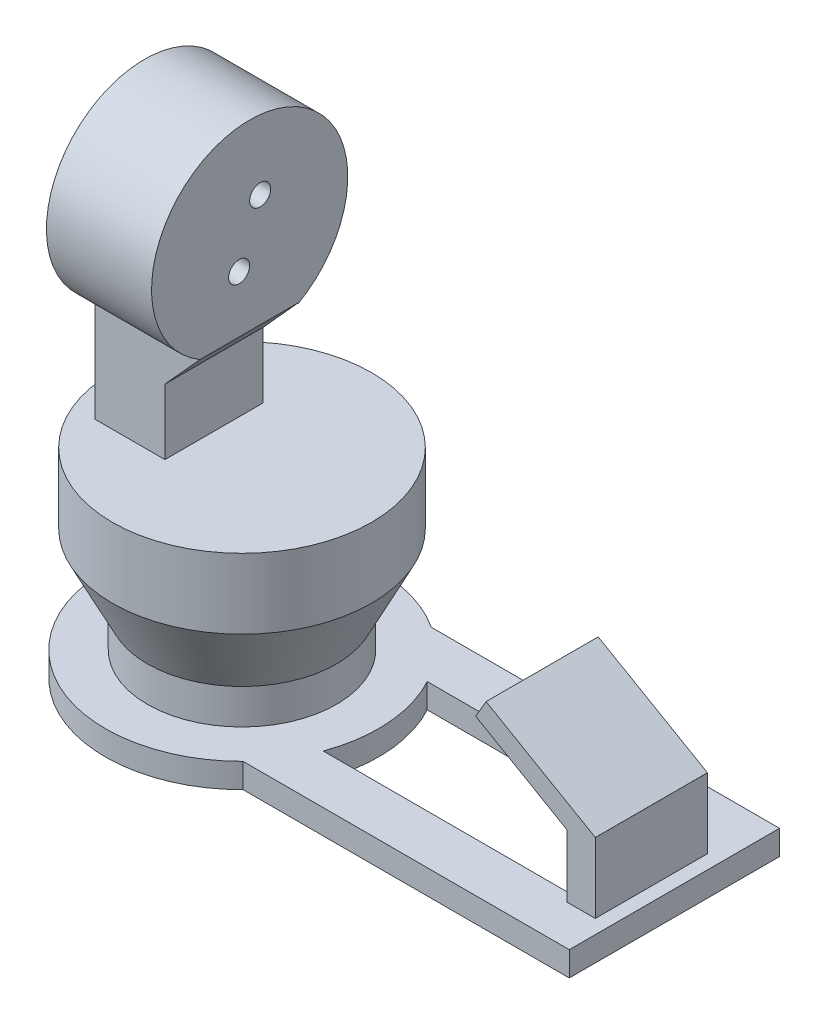
from build123d import *

# Parameters (mm, degrees)
SALIENTE_EXTRUIR1_DEPTH = 3.5
CROQUIS2_R              = 13.5
SALIENTE_EXTRUIR2_DEPTH = 5
CROQUIS4_R              = 18.5
CROQUIS5_R              = 13.5
CROQUIS6_R              = 18.5
SALIENTE_EXTRUIR3_DEPTH = 10
CROQUIS7_W              = 10
CROQUIS7_H              = 14
SALIENTE_EXTRUIR4_DEPTH = 9.335
SALIENTE_EXTRUIR5_DEPTH = 7
SALIENTE_EXTRUIR6_DEPTH = 15
SALIENTE_EXTRUIR7_DEPTH = 8
CROQUIS11_R             = 1.5
CORTAR_EXTRUIR1_DEPTH   = 104.624142837


with BuildPart() as part:
    # Croquis1 → Saliente-Extruir1 (new body)
    with BuildSketch(Plane(origin=(0, 0, 0), x_dir=(1, 0, 0), z_dir=(0, 1, 0))):
        with BuildLine():
            Line((13.865110625, -13.711626722), (60.412611283, -13.711626722))
            Line((60.412611283, -13.711626722), (60.412611283, 16.288373278))
            Line((60.412611283, 16.288373278), (10.720955925, 16.288373278))
            ThreePointArc((10.720955925, 16.288373278), (-19.393779083, -2.032568055), (13.865110625, -13.711626722))
        make_face()
        with BuildLine():
            Line((53.412611283, -6.711626722), (18.308579048, -6.711626722))
            ThreePointArc((18.308579048, -6.711626722), (19.448702808, 1.413491806), (17.145731884, 9.288373278))
            Line((17.145731884, 9.288373278), (53.412611283, 9.288373278))
            Line((53.412611283, 9.288373278), (53.412611283, -6.711626722))
        make_face(mode=Mode.SUBTRACT)
    extrude(amount=SALIENTE_EXTRUIR1_DEPTH)

    # Croquis2 → Saliente-Extruir2 (add)
    with BuildSketch(Plane(origin=(0, 3.5, 0), x_dir=(1, 0, 0), z_dir=(0, 1, 0))):
        Circle(CROQUIS2_R)
    extrude(amount=SALIENTE_EXTRUIR2_DEPTH)

    # Croquis4 → Recubrir2 section 0
    with BuildSketch(Plane(origin=(0, 18.5, 0), x_dir=(1, 0, 0), z_dir=(0, 1, 0))):
        Circle(CROQUIS4_R)
    # Croquis5 → Recubrir2 section 1
    with BuildSketch(Plane(origin=(0, 8.5, 0), x_dir=(1, 0, 0), z_dir=(0, 1, 0))):
        Circle(CROQUIS5_R)
    loft()

    # Croquis6 → Saliente-Extruir3 (add)
    with BuildSketch(Plane(origin=(0, 18.5, 0), x_dir=(1, 0, 0), z_dir=(0, 1, 0))):
        Circle(CROQUIS6_R)
    extrude(amount=SALIENTE_EXTRUIR3_DEPTH)

    # Croquis7 → Saliente-Extruir4 (add)
    with BuildSketch(Plane(origin=(0, 28.5, 0), x_dir=(1, 0, 0), z_dir=(0, 1, 0))):
        with Locations((-8.995895444, 0)):
            Rectangle(CROQUIS7_W, CROQUIS7_H)
    extrude(amount=SALIENTE_EXTRUIR4_DEPTH)

    # Croquis8 → Saliente-Extruir5 (add, symmetric)
    with BuildSketch(Plane.XY):
        Polygon((-13.995895444, 37.835), (-13.995895444, 43.365), (1.004104556, 43.365), (-3.995895444, 37.835), align=None)
    extrude(amount=SALIENTE_EXTRUIR5_DEPTH, both=True)

    # Croquis9 → Saliente-Extruir6 (add)
    with BuildSketch(Plane.ZY.offset(13.995895444)):
        with BuildLine():
            Line((-7, 43.257226645), (-7, 43.365))
            Line((-7, 43.365), (7, 43.365))
            Line((7, 43.365), (7, 43.363083448))
            ThreePointArc((7, 43.363083448), (12.059118842, 48.480035252), (13.908328814, 55.434048604))
            ThreePointArc((13.908328814, 55.434048604), (-7.13735769, 67.531912122), (-7, 43.257226645))
        make_face()
    extrude(amount=-SALIENTE_EXTRUIR6_DEPTH)

    # Croquis10 → Saliente-Extruir7 (add, symmetric)
    with BuildSketch(Plane.XY):
        Polygon((58.412611283, 3.5), (54.412611283, 3.5), (54.412611283, 12.42), (41.356500297, 19.957949192), (42.831821975, 22.513281297), (58.420279243, 13.513281297), (58.412611283, 13.5), align=None)
    extrude(amount=SALIENTE_EXTRUIR7_DEPTH, both=True)

    # Croquis11 → Cortar-Extruir1 (cut, through all)
    with BuildSketch(Plane.ZY.offset(13.995895444)):
        with Locations((-1.591671186, 59.434048604)):
            Circle(CROQUIS11_R)
        with Locations((1.408328814, 51.434048604)):
            Circle(CROQUIS11_R)
    extrude(amount=-CORTAR_EXTRUIR1_DEPTH, mode=Mode.SUBTRACT)


solid = part.part
